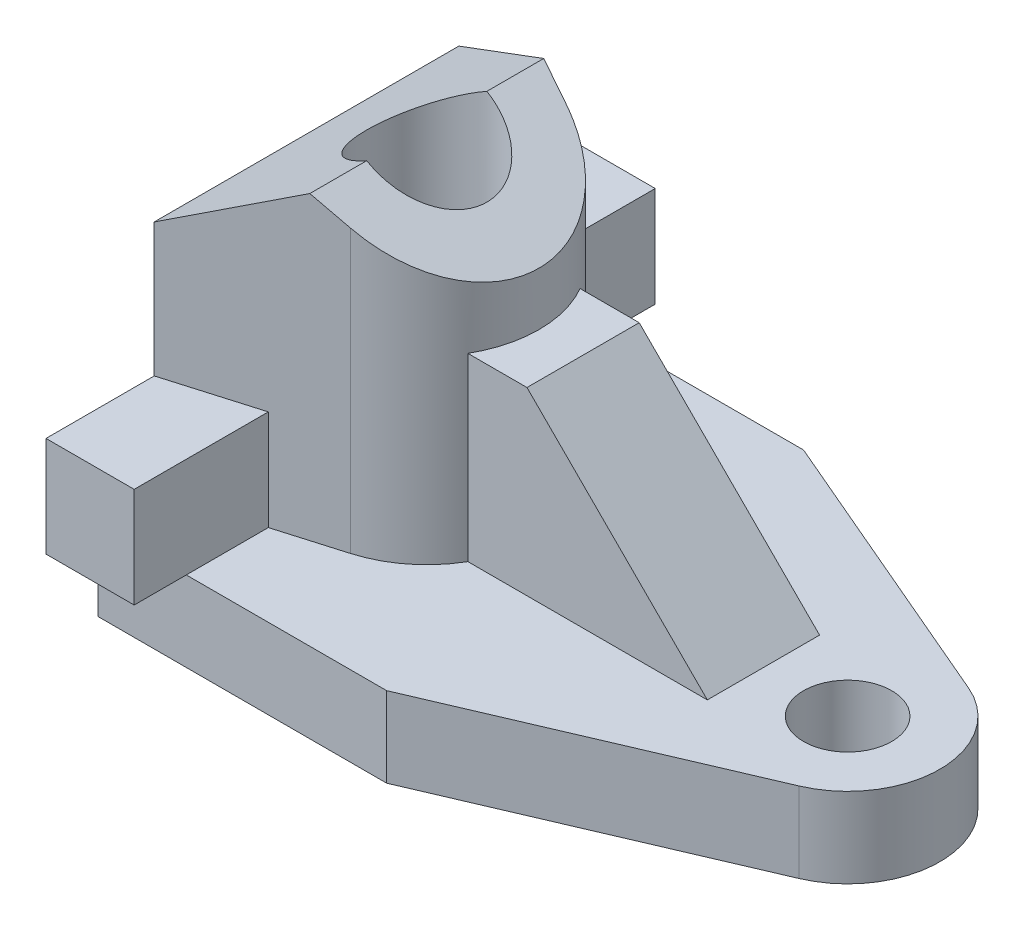
from build123d import *

# Parameters (mm, degrees)
BOSS_EXTRUDE2_DEPTH = 10
SKETCH2_R           = 5.5
CUT_EXTRUDE1_DEPTH  = 10
SKETCH3_W           = 11
SKETCH3_H           = 65
BOSS_EXTRUDE3_DEPTH = 12.5
BOSS_EXTRUDE4_START = -10
BOSS_EXTRUDE4_DEPTH = 47.5
SKETCH7_R           = 7.5
CUT_EXTRUDE2_DEPTH  = 89.705974996
RIB1_START          = -7
RIB1_DEPTH          = 14
CUT_EXTRUDE3_START  = -19
CUT_EXTRUDE3_DEPTH  = 38


# Read off the part's stored shape, not the designer's step: Rib1, Cut-Extrude3
with BuildPart() as part:
    # Sketch1 → Boss-Extrude2 (new body)
    with BuildSketch(Plane(origin=(0, 0, 0), x_dir=(1, 0, 0), z_dir=(0, 1, 0))):
        with BuildLine():
            Line((-67.5, 26), (-67.5, -26))
            Line((-67.5, -26), (-31.5, -26))
            Line((-31.5, -26), (4.527189528, -10.571402697))
            ThreePointArc((4.527189528, -10.571402697), (11.5, 0), (4.527189528, 10.571402697))
            Line((4.527189528, 10.571402697), (-31.5, 26))
            Line((-31.5, 26), (-67.5, 26))
        make_face()
    extrude(amount=BOSS_EXTRUDE2_DEPTH)

    # Sketch2 → Cut-Extrude1 (cut)
    with BuildSketch(Plane(origin=(0, 10, 0), x_dir=(1, 0, 0), z_dir=(0, 1, 0))):
        with Locations(Location((0, 0, 0), (0, 0, 270))):
            Circle(SKETCH2_R)
    extrude(amount=-CUT_EXTRUDE1_DEPTH, mode=Mode.SUBTRACT)

    # Sketch3 → Boss-Extrude3 (add)
    with BuildSketch(Plane(origin=(0, 10, 0), x_dir=(1, 0, 0), z_dir=(0, 1, 0))):
        with Locations((-62, 0)):
            Rectangle(SKETCH3_W, SKETCH3_H)
    extrude(amount=BOSS_EXTRUDE3_DEPTH)

    # Sketch4 → Boss-Extrude4 (add)
    with BuildSketch(Plane(origin=(0, 10, 0), x_dir=(1, 0, 0), z_dir=(0, 1, 0)).offset(BOSS_EXTRUDE4_START)):
        with BuildLine():
            Line((-67.5, 19), (-67.5, -19))
            Line((-67.5, -19), (-48.552766046, -13.432026806))
            ThreePointArc((-48.552766046, -13.432026806), (-38.5, 0), (-48.552766046, 13.432026806))
            Line((-48.552766046, 13.432026806), (-67.5, 19))
        make_face()
    extrude(amount=BOSS_EXTRUDE4_DEPTH)

    # Sketch6 → Hole1 (revolve, cut)
    with BuildSketch(Plane(origin=(-52.5, 10, 0), x_dir=(0, 0, 1), z_dir=(1, 0, 0))):
        Polygon((0, 0), (0, 10), (7, 10), (7, 15), (10, 15), (10, 0), align=None)
    revolve(axis=Axis((-52.5, -100, 0), (0, 1, 0)), mode=Mode.SUBTRACT)

    # Sketch7 → Cut-Extrude2 (cut, through all)
    with BuildSketch(Plane(origin=(0, 47.5, 0), x_dir=(1, 0, 0), z_dir=(0, 1, 0))):
        with Locations(Location((-52.5, 0, 0), (0, 0, 270))):
            Circle(SKETCH7_R)
    extrude(amount=-CUT_EXTRUDE2_DEPTH, mode=Mode.SUBTRACT)

    # Rib1 outline → Rib1 (add)
    with BuildSketch(Plane.XY.offset(RIB1_START)):
        Polygon((-33, 32.5), (-42, 32.5), (-42, 10), (-10.5, 10), align=None)
    extrude(amount=RIB1_DEPTH)

    # Cut-Extrude3 outline → Cut-Extrude3 (cut)
    with BuildSketch(Plane.XY.offset(CUT_EXTRUDE3_START)):
        Polygon((-37, 47.5), (-52.5, 47.5), (-38.5, 39.135888498), (-37, 38.239733694), align=None)
        Polygon((-67.5, 39.135888498), (-52.5, 47.5), (-67.5, 47.5), align=None)
    extrude(amount=CUT_EXTRUDE3_DEPTH, mode=Mode.SUBTRACT)


solid = part.part
